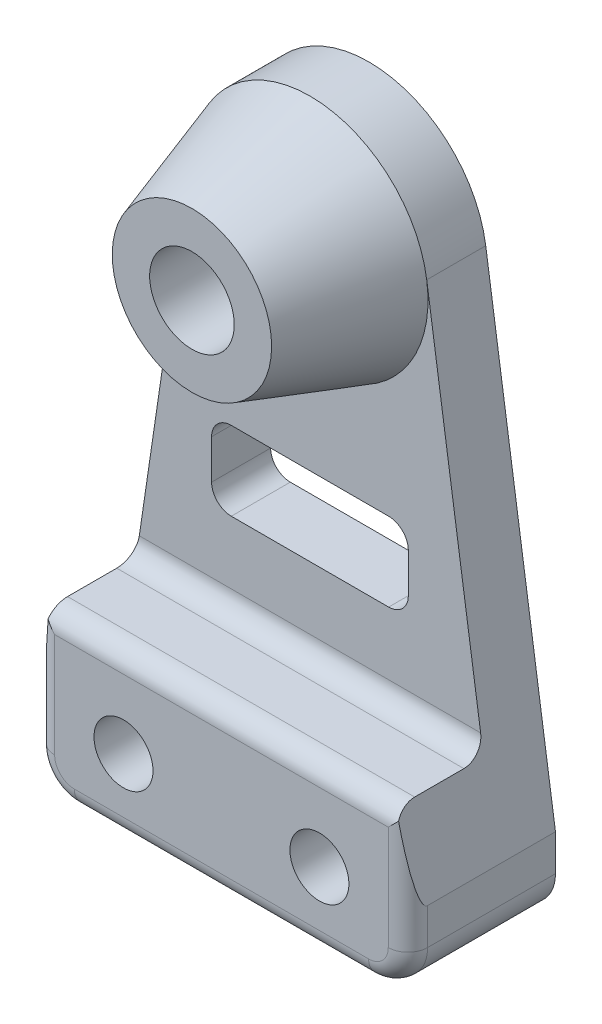
from build123d import *

# Parameters (mm, degrees)
SKETCH1_R       = 2.15
SKETCH1_R_2     = 1.5
EXTRUDE1_DEPTH  = 3
SKETCH2_R       = 6
SKETCH2_R_2     = 2.15
EXTRUDE2_DEPTH  = 6
EXTRUDE3_DEPTH  = 3
SKETCH4_R       = 1.5
EXTRUDE4_DEPTH  = 4.5
FILLET5_R       = 1
CHAMFER1_SIZE   = 6
CHAMFER1_SIZE_2 = 1.949518177


with BuildPart() as part:
    # Sketch1 → Extrude1 (new body)
    with BuildSketch(Plane.XY):
        with BuildLine():
            Line((-7.48, -27), (7.48, -27))
            ThreePointArc((7.48, -27), (8.894213562, -26.414213562), (9.48, -25))
            Line((9.48, -25), (9.48, -23.15))
            Line((9.48, -23.15), (5.935760988, 0.875637761))
            ThreePointArc((5.935760988, 0.875637761), (0, 6), (-5.935760988, 0.875637761))
            Line((-5.935760988, 0.875637761), (-9.48, -23.15))
            Line((-9.48, -23.15), (-9.48, -25))
            ThreePointArc((-9.48, -25), (-8.894213562, -26.414213562), (-7.48, -27))
        make_face()
        Circle(SKETCH1_R, mode=Mode.SUBTRACT)
        with Locations((-4.98, -23.2)):
            Circle(SKETCH1_R_2, mode=Mode.SUBTRACT)
        with Locations((4.98, -23.2)):
            Circle(SKETCH1_R_2, mode=Mode.SUBTRACT)
    extrude(amount=EXTRUDE1_DEPTH)

    # Sketch2 → Extrude2 (add)
    with BuildSketch(Plane.XY.offset(3)):
        with Locations(Location((0, 0, 0), (0, 0, 171.608305322))):
            Circle(SKETCH2_R)
        Circle(SKETCH2_R_2, mode=Mode.SUBTRACT)
    extrude(amount=EXTRUDE2_DEPTH)

    # Sketch3 → Extrude3 (cut)
    with BuildSketch(Plane.XY.offset(3)):
        with BuildLine():
            Line((-4, -10.5), (4, -10.5))
            ThreePointArc((4, -10.5), (4.707106781, -10.792893219), (5, -11.5))
            Line((5, -11.5), (5, -13.5))
            ThreePointArc((5, -13.5), (4.707106781, -14.207106781), (4, -14.5))
            Line((4, -14.5), (-4, -14.5))
            ThreePointArc((-4, -14.5), (-4.707106781, -14.207106781), (-5, -13.5))
            Line((-5, -13.5), (-5, -11.5))
            ThreePointArc((-5, -11.5), (-4.707106781, -10.792893219), (-4, -10.5))
        make_face()
    extrude(amount=-EXTRUDE3_DEPTH, mode=Mode.SUBTRACT)

    # Sketch4 → Extrude4 (add)
    with BuildSketch(Plane.XY.offset(3)):
        with BuildLine():
            Line((-7.48, -27), (7.48, -27))
            ThreePointArc((7.48, -27), (8.894213562, -26.414213562), (9.48, -25))
            Line((9.48, -25), (9.48, -23.15))
            Line((9.48, -23.15), (8.823540273, -18.7))
            Line((8.823540273, -18.7), (-8.823540273, -18.7))
            Line((-8.823540273, -18.7), (-9.48, -23.15))
            Line((-9.48, -23.15), (-9.48, -25))
            ThreePointArc((-9.48, -25), (-8.894213562, -26.414213562), (-7.48, -27))
        make_face()
        with Locations((-4.98, -23.2)):
            Circle(SKETCH4_R, mode=Mode.SUBTRACT)
        with Locations((4.98, -23.2)):
            Circle(SKETCH4_R, mode=Mode.SUBTRACT)
    extrude(amount=EXTRUDE4_DEPTH)

    # Fillet5
    # the kernel refuses this fillet: 1 mm, written as the material it adds along each edge
    with BuildSketch(Plane(origin=(14.823540273, -18.7, 3), x_dir=(0, 0, 1), z_dir=(-1, 0, 0))) as fillet5_piece_1_section:
        with BuildLine():
            CenterArc((FILLET5_R, FILLET5_R), FILLET5_R, 180, 90)
            Line((0, FILLET5_R), (-FILLET5_R * 0.02, FILLET5_R))
            Line((-FILLET5_R * 0.02, FILLET5_R), (-FILLET5_R * 0.02, -FILLET5_R * 0.02))
            Line((-FILLET5_R * 0.02, -FILLET5_R * 0.02), (FILLET5_R, -FILLET5_R * 0.02))
            Line((FILLET5_R, -FILLET5_R * 0.02), (FILLET5_R, 0))
        make_face()
    fillet5_piece_1 = extrude(amount=29.647080546, mode=Mode.PRIVATE)
    fillet5_piece_1 = split(fillet5_piece_1, bisect_by=Plane(origin=(-8.603039543, -17.20527274, 3.226855902), z_dir=(0.9892934980650984, -0.1459396268534398, 0)), keep=Keep.TOP, mode=Mode.PRIVATE)
    fillet5_piece_1 = split(fillet5_piece_1, bisect_by=Plane(origin=(8.603039543, -17.20527274, 3.226855902), z_dir=(-0.9892934980650984, -0.14593962685343984, 0)), keep=Keep.TOP, mode=Mode.PRIVATE)
    add(fillet5_piece_1)
    # the kernel refuses this fillet: 1 mm, written as the material it takes off along each edge
    with BuildSketch(Plane(origin=(-9.48, -17.15, 7.5), x_dir=(0, 0, -1), z_dir=(0, -1, 0))) as fillet5_2_piece_1:
        with BuildLine():
            CenterArc((FILLET5_R, FILLET5_R), FILLET5_R, 180, 90)
            Line((0, FILLET5_R), (-FILLET5_R * 0.02, FILLET5_R))
            Line((-FILLET5_R * 0.02, FILLET5_R), (-FILLET5_R * 0.02, -FILLET5_R * 0.02))
            Line((-FILLET5_R * 0.02, -FILLET5_R * 0.02), (FILLET5_R, -FILLET5_R * 0.02))
            Line((FILLET5_R, -FILLET5_R * 0.02), (FILLET5_R, 0))
        make_face()
    extrude(amount=7.85, mode=Mode.SUBTRACT)
    with BuildSketch(Plane(origin=(9.48, -25, 7.5), x_dir=(-1, 0, 0), z_dir=(0, 1, 0))) as fillet5_2_piece_2:
        with BuildLine():
            CenterArc((FILLET5_R, -FILLET5_R), FILLET5_R, 90, 90)
            Line((0, -FILLET5_R), (-FILLET5_R * 0.02, -FILLET5_R))
            Line((-FILLET5_R * 0.02, -FILLET5_R), (-FILLET5_R * 0.02, FILLET5_R * 0.02))
            Line((-FILLET5_R * 0.02, FILLET5_R * 0.02), (FILLET5_R, FILLET5_R * 0.02))
            Line((FILLET5_R, FILLET5_R * 0.02), (FILLET5_R, 0))
        make_face()
    extrude(amount=7.85, mode=Mode.SUBTRACT)
    with BuildSketch(Plane(origin=(-7.48, -27, 7.5), x_dir=(0, 1, 0), z_dir=(1, 0, 0))) as fillet5_2_piece_3:
        with BuildLine():
            CenterArc((FILLET5_R, -FILLET5_R), FILLET5_R, 90, 90)
            Line((0, -FILLET5_R), (-FILLET5_R * 0.02, -FILLET5_R))
            Line((-FILLET5_R * 0.02, -FILLET5_R), (-FILLET5_R * 0.02, FILLET5_R * 0.02))
            Line((-FILLET5_R * 0.02, FILLET5_R * 0.02), (FILLET5_R, FILLET5_R * 0.02))
            Line((FILLET5_R, FILLET5_R * 0.02), (FILLET5_R, 0))
        make_face()
    extrude(amount=14.96, mode=Mode.SUBTRACT)
    with BuildSketch(Plane(origin=(14.823540273, -18.7, 7.5), x_dir=(0, -1, 0), z_dir=(-1, 0, 0))) as fillet5_2_piece_4:
        with BuildLine():
            CenterArc((FILLET5_R, -FILLET5_R), FILLET5_R, 90, 90)
            Line((0, -FILLET5_R), (-FILLET5_R * 0.02, -FILLET5_R))
            Line((-FILLET5_R * 0.02, -FILLET5_R), (-FILLET5_R * 0.02, FILLET5_R * 0.02))
            Line((-FILLET5_R * 0.02, FILLET5_R * 0.02), (FILLET5_R, FILLET5_R * 0.02))
            Line((FILLET5_R, FILLET5_R * 0.02), (FILLET5_R, 0))
        make_face()
    extrude(amount=29.647080546, mode=Mode.SUBTRACT)
    with BuildSketch(Plane(origin=(-7.48, -25, 7.5), x_dir=(-1, 0, 0), z_dir=(0, 1, 0))) as fillet5_2_piece_5:
        with BuildLine():
            CenterArc((2 - FILLET5_R, -FILLET5_R), FILLET5_R, 0, 90)
            Line((2, -FILLET5_R), (2 + FILLET5_R * 0.02, -FILLET5_R))
            Line((2 + FILLET5_R * 0.02, -FILLET5_R), (2 + FILLET5_R * 0.02, FILLET5_R * 0.02))
            Line((2 + FILLET5_R * 0.02, FILLET5_R * 0.02), (2 - FILLET5_R, FILLET5_R * 0.02))
            Line((2 - FILLET5_R, FILLET5_R * 0.02), (2 - FILLET5_R, 0))
        make_face()
    revolve(axis=Axis((-7.48, -25, 7.5), (0, 0, 1)), revolution_arc=90, mode=Mode.SUBTRACT)
    with BuildSketch(Plane(origin=(7.48, -25, 7.5), x_dir=(0, -1, 0), z_dir=(-1, 0, 0))) as fillet5_2_piece_6:
        with BuildLine():
            CenterArc((2 - FILLET5_R, -FILLET5_R), FILLET5_R, 0, 90)
            Line((2, -FILLET5_R), (2 + FILLET5_R * 0.02, -FILLET5_R))
            Line((2 + FILLET5_R * 0.02, -FILLET5_R), (2 + FILLET5_R * 0.02, FILLET5_R * 0.02))
            Line((2 + FILLET5_R * 0.02, FILLET5_R * 0.02), (2 - FILLET5_R, FILLET5_R * 0.02))
            Line((2 - FILLET5_R, FILLET5_R * 0.02), (2 - FILLET5_R, 0))
        make_face()
    revolve(axis=Axis((7.48, -25, 7.5), (0, 0, 1)), revolution_arc=90, mode=Mode.SUBTRACT)

    # Chamfer1
    # the kernel refuses this chamfer: 6, 1.949518177 mm, written as the material it takes off along each edge
    with BuildSketch(Plane(origin=(0, 0, 9), x_dir=(-0.9892934980663286, 0.14593962684510065, 0), z_dir=(0.14593962684510065, 0.9892934980663286, 0))) as chamfer1_piece_1_section:
        Polygon((6, -CHAMFER1_SIZE), (6 - CHAMFER1_SIZE_2, 0), (6, 0), align=None)
    chamfer1_piece_1 = revolve(axis=Axis((0, 0, 9), (0, 0, 1)), mode=Mode.PRIVATE)
    chamfer1_piece_1 = split(chamfer1_piece_1, bisect_by=Plane(origin=(4.992893688, -0.736546882, 3), z_dir=(0, 0, 1)), keep=Keep.TOP, mode=Mode.PRIVATE)
    add(chamfer1_piece_1, mode=Mode.SUBTRACT)


solid = part.part
